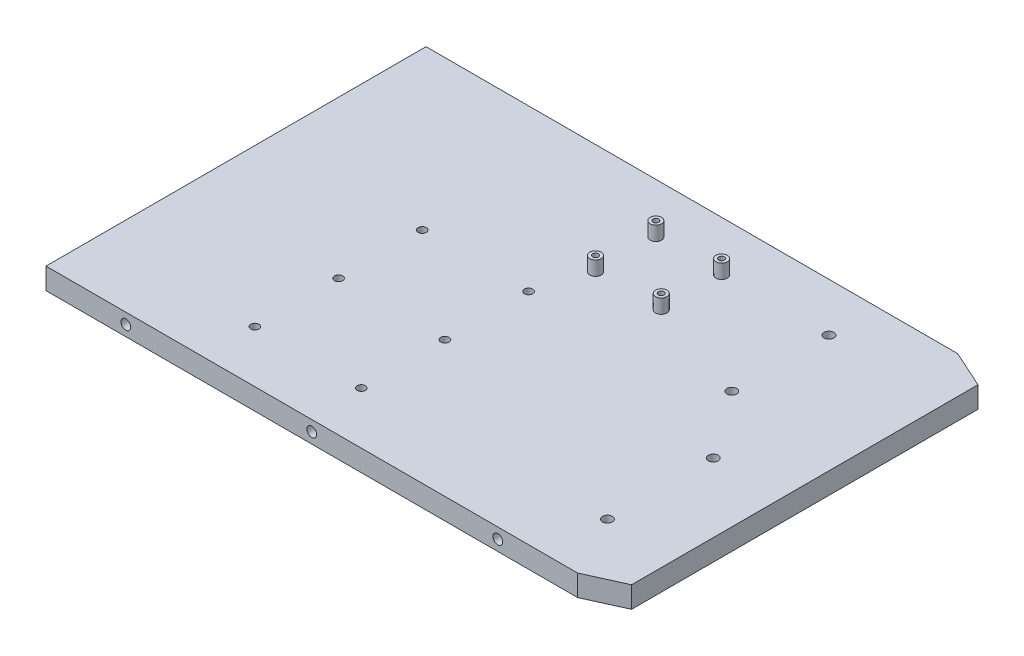
from build123d import *

# Parameters (mm, degrees)
BOSS_EXTRUDE1_DEPTH   = 10
SKETCH2_R             = 2.925
SKETCH2_R_2           = 3.455
SKETCH2_R_3           = 3.45
BOSS_EXTRUDE3_DEPTH   = 5
SKETCH3_R             = 4
SKETCH3_R_2           = 2
BOSS_EXTRUDE4_DEPTH   = 10
BOSS_EXTRUDE4_2_DEPTH = 10
BOSS_EXTRUDE4_3_DEPTH = 10
BOSS_EXTRUDE4_4_DEPTH = 10
SKETCH4_W             = 374.81
SKETCH4_H             = 15
SKETCH4_R             = 3.455
BOSS_EXTRUDE5_DEPTH   = 5.7
BOSS_EXTRUDE6_START   = 5.7
SKETCH5_W             = 374.81
SKETCH5_H             = 15
SKETCH5_R             = 3.455
BOSS_EXTRUDE6_DEPTH   = 5.7


with BuildPart() as part:
    # Sketch1 → Boss-Extrude1 (new body)
    with BuildSketch(Plane(origin=(0, 0, 0), x_dir=(1, 0, 0), z_dir=(0, 1, 0))):
        Polygon((0, 12.033084577), (0, 268.596915423), (374.81, 268.596915423), (374.81, 274.296915423), (401.01, 262.445), (401.01, 18.185), (374.81, 6.333084577), (374.81, 12.033084577), align=None)
    extrude(amount=BOSS_EXTRUDE1_DEPTH)



with BuildPart() as body_2:
    # Sketch2 → Boss-Extrude3 (new body)
    with BuildSketch(Plane(origin=(0, 10, 0), x_dir=(1, 0, 0), z_dir=(0, 1, 0))):
        Polygon((374.81, 268.596915423), (0, 268.596915423), (0, 12.033084577), (374.81, 12.033084577), (374.81, 6.333084577), (401.01, 18.185), (401.01, 262.445), (374.81, 274.296915423), align=None)
        with Locations((110.598476412, 43.016832694)):
            Circle(SKETCH2_R, mode=Mode.SUBTRACT)
        with Locations((185.598476412, 43.016832694)):
            Circle(SKETCH2_R, mode=Mode.SUBTRACT)
        with Locations((110.598476412, 102.016832694)):
            Circle(SKETCH2_R, mode=Mode.SUBTRACT)
        with Locations((185.598476412, 102.016832694)):
            Circle(SKETCH2_R, mode=Mode.SUBTRACT)
        with Locations((352.434052915, 49.730316665)):
            Circle(SKETCH2_R_2, mode=Mode.SUBTRACT)
        with Locations((352.434052915, 124.380316665)):
            Circle(SKETCH2_R_2, mode=Mode.SUBTRACT)
        with Locations((110.598476412, 161.016832694)):
            Circle(SKETCH2_R, mode=Mode.SUBTRACT)
        with Locations((185.598476412, 161.016832694)):
            Circle(SKETCH2_R, mode=Mode.SUBTRACT)
        with Locations((318.184052915, 171.68469423)):
            Circle(SKETCH2_R_3, mode=Mode.SUBTRACT)
        with Locations((318.184052915, 240.18469423)):
            Circle(SKETCH2_R_3, mode=Mode.SUBTRACT)
    extrude(amount=BOSS_EXTRUDE3_DEPTH)


with BuildPart() as body_3:
    # Sketch3 → Boss-Extrude4 (new body)
    with BuildSketch(Plane(origin=(0, 15, 0), x_dir=(1, 0, 0), z_dir=(0, 1, 0))):
        with Locations((197.186302821, 196.582002179)):
            Circle(SKETCH3_R)
        with Locations((197.186302821, 196.582002179)):
            Circle(SKETCH3_R_2, mode=Mode.SUBTRACT)
    extrude(amount=BOSS_EXTRUDE4_DEPTH)


with BuildPart() as body_4:
    # Sketch3 → Boss-Extrude4 2 (new body)
    with BuildSketch(Plane(origin=(0, 15, 0), x_dir=(1, 0, 0), z_dir=(0, 1, 0))):
        with Locations((197.186302821, 239.127002179)):
            Circle(SKETCH3_R)
        with Locations((197.186302821, 239.127002179)):
            Circle(SKETCH3_R_2, mode=Mode.SUBTRACT)
    extrude(amount=BOSS_EXTRUDE4_2_DEPTH)


with BuildPart() as body_5:
    # Sketch3 → Boss-Extrude4 3 (new body)
    with BuildSketch(Plane(origin=(0, 15, 0), x_dir=(1, 0, 0), z_dir=(0, 1, 0))):
        with Locations((243.541302821, 239.127002179)):
            Circle(SKETCH3_R)
        with Locations((243.541302821, 239.127002179)):
            Circle(SKETCH3_R_2, mode=Mode.SUBTRACT)
    extrude(amount=BOSS_EXTRUDE4_3_DEPTH)


with BuildPart() as body_6:
    # Sketch3 → Boss-Extrude4 4 (new body)
    with BuildSketch(Plane(origin=(0, 15, 0), x_dir=(1, 0, 0), z_dir=(0, 1, 0))):
        with Locations((243.541302821, 196.582002179)):
            Circle(SKETCH3_R)
        with Locations((243.541302821, 196.582002179)):
            Circle(SKETCH3_R_2, mode=Mode.SUBTRACT)
    extrude(amount=BOSS_EXTRUDE4_4_DEPTH)


with BuildPart() as part_1:
    add(part.part)

    add(body_2.part)  # Boss-Extrude5 merges body 2
    # Sketch4 → Boss-Extrude5 (add)
    with BuildSketch(Plane.XY.offset(-12.033084577)):
        with Locations((187.405, 7.5)):
            Rectangle(SKETCH4_W, SKETCH4_H)
        with Locations((187.405, 7.5)):
            Circle(SKETCH4_R, mode=Mode.SUBTRACT)
        with Locations((56.269425864, 7.5)):
            Circle(SKETCH4_R, mode=Mode.SUBTRACT)
        with Locations((318.540574136, 7.5)):
            Circle(SKETCH4_R, mode=Mode.SUBTRACT)
    extrude(amount=BOSS_EXTRUDE5_DEPTH)

    # Sketch5 → Boss-Extrude6 (add)
    with BuildSketch(Plane(origin=(0, 0, -268.596915423), x_dir=(-1, 0, 0), z_dir=(0, 0, -1)).offset(BOSS_EXTRUDE6_START)):
        with Locations((-187.405, 7.5)):
            Rectangle(SKETCH5_W, SKETCH5_H)
        with Locations((-187.405, 7.5)):
            Circle(SKETCH5_R, mode=Mode.SUBTRACT)
        with Locations((-318.540574136, 7.5)):
            Circle(SKETCH5_R, mode=Mode.SUBTRACT)
        with Locations((-56.269425864, 7.5)):
            Circle(SKETCH5_R, mode=Mode.SUBTRACT)
    extrude(amount=-BOSS_EXTRUDE6_DEPTH)


solid = Compound([body_3.part, body_4.part, body_5.part, body_6.part, part_1.part])
